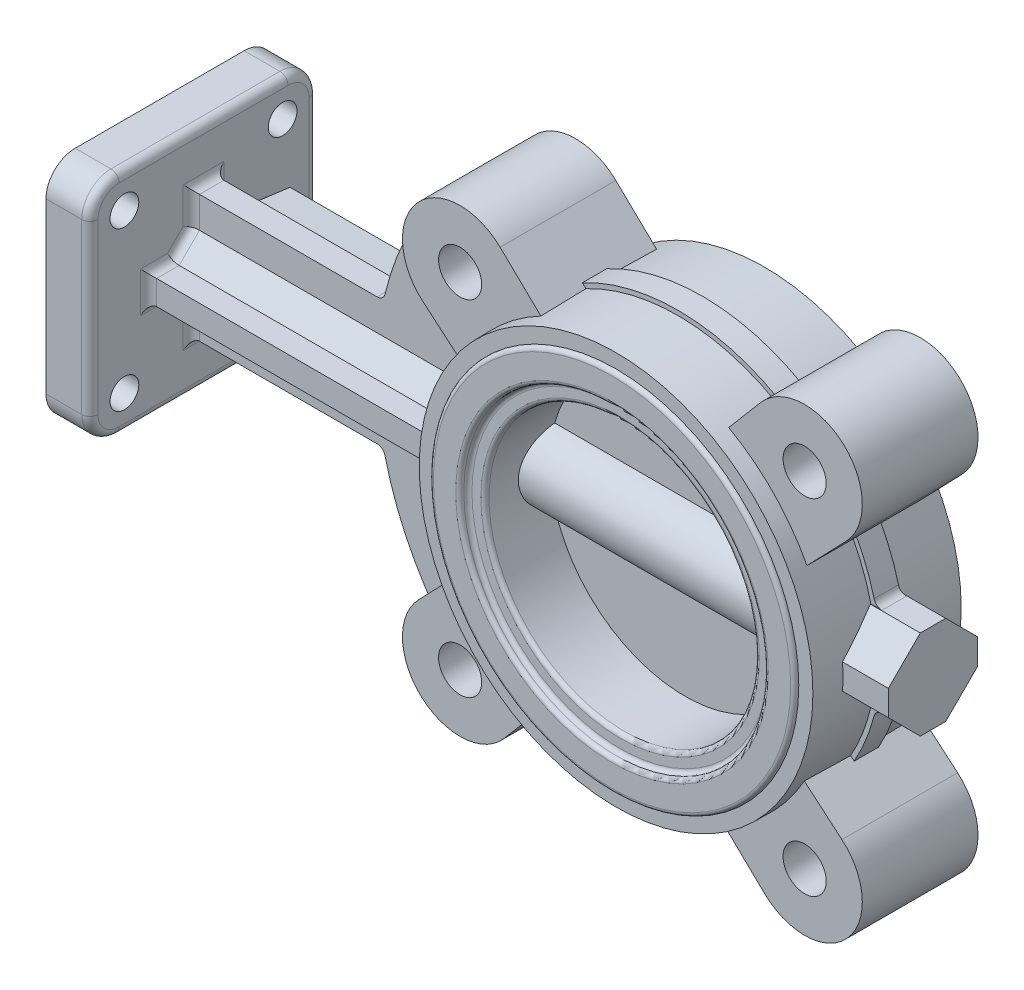
from build123d import *

# Parameters (mm, degrees)
SKETCH1_R                     = 61.976
BOSS_EXTRUDE1_DEPTH           = 23.19655
BOSS_EXTRUDE1_TAPER           = 1
BOSS_EXTRUDE1_OTHER_WAY_DEPTH = 23.19655
BOSS_EXTRUDE1_OTHER_WAY_TAPER = 1
SKETCH2_R                     = 57.15
BOSS_EXTRUDE2_DEPTH           = 1.27
BOSS_EXTRUDE3_START           = 1.27
SKETCH3_R                     = 57.15
BOSS_EXTRUDE3_DEPTH           = 1.27
SKETCH4_R                     = 47.625
CUT_EXTRUDE1_DEPTH            = 2.54
CUT_EXTRUDE2_START            = -2.54
SKETCH5_R                     = 47.625
CUT_EXTRUDE2_DEPTH            = 2.54
SKETCH6_R                     = 42.291
CUT_EXTRUDE3_DEPTH            = 100.168386618
SKETCH7_W                     = 6.35
SKETCH7_H                     = 7.62
SKETCH8_W                     = 27.94
SKETCH8_H                     = 27.94
BOSS_EXTRUDE4_DEPTH           = 18.796
CHAMFER1_SIZE                 = 10
BOSS_EXTRUDE5_DEPTH           = 88.9
BOSS_EXTRUDE5_DEPTH_BACK      = 12.7
BOSS_EXTRUDE6_DEPTH           = 7.62
SKETCH11_W                    = 71.12
SKETCH11_H                    = 71.12
BOSS_EXTRUDE7_DEPTH           = 13.716
CHAMFER2_SIZE                 = 6.35
FILLET1_R                     = 9.144
SKETCH12_W                    = 57.15
SKETCH12_H                    = 31.75
BOSS_EXTRUDE8_DEPTH           = 13.4112
BOSS_EXTRUDE8_TAPER           = 4
FILLET2_R                     = 1.27
FILLET3_R                     = 2.54
SKETCH14_R                    = 9.525
CUT_EXTRUDE5_DEPTH            = 7.62
M8_CLEARANCE_HOLE1_D          = 9
M8_CLEARANCE_HOLE1_DEPTH      = 13.716
SKETCH18_R                    = 11.5
BOSS_EXTRUDE9_DEPTH           = 127
SKETCH19_R                    = 7
BOSS_EXTRUDE10_DEPTH          = 6.62
BOSS_EXTRUDE11_DEPTH          = 19
CHAMFER3_SIZE                 = 1.5
SKETCH21_R                    = 42.291
BOSS_EXTRUDE12_DEPTH          = 1.665
BOSS_EXTRUDE13_DEPTH          = 18.0975
CIRPATTERN1_COUNT             = 4
F_5_8_11_TAPPED_HOLE1_D       = 13.49248


# Some blends are built 0.0001 mm under size
with BuildPart() as part:
    # Sketch1 → Boss-Extrude1 (new body)
    with BuildSketch(Plane.XY):
        Circle(SKETCH1_R)
    extrude(amount=BOSS_EXTRUDE1_DEPTH, taper=BOSS_EXTRUDE1_TAPER)

    # Sketch1 → Boss-Extrude1 other way (add)
    with BuildSketch(Plane.XY):
        Circle(SKETCH1_R)
    extrude(amount=-BOSS_EXTRUDE1_OTHER_WAY_DEPTH, taper=BOSS_EXTRUDE1_OTHER_WAY_TAPER)

    # Sketch2 → Boss-Extrude2 (add)
    with BuildSketch(Plane.XY.offset(23.19655)):
        Circle(SKETCH2_R)
    extrude(amount=BOSS_EXTRUDE2_DEPTH)

    # Sketch3 → Boss-Extrude3 (add)
    with BuildSketch(Plane(origin=(0, 0, -23.19655), x_dir=(-1, 0, 0), z_dir=(0, 0, -1)).offset(BOSS_EXTRUDE3_START)):
        with Locations(Location((0, 0, 0), (0, 0, 180))):
            Circle(SKETCH3_R)
    extrude(amount=-BOSS_EXTRUDE3_DEPTH)

    # Sketch4 → Cut-Extrude1 (cut)
    with BuildSketch(Plane(origin=(0, 0, -24.46655), x_dir=(-1, 0, 0), z_dir=(0, 0, -1))):
        Circle(SKETCH4_R)
    extrude(amount=-CUT_EXTRUDE1_DEPTH, mode=Mode.SUBTRACT)

    # Sketch5 → Cut-Extrude2 (cut)
    with BuildSketch(Plane.XY.offset(24.46655).offset(CUT_EXTRUDE2_START)):
        with Locations(Location((0, 0, 0), (0, 0, 180))):
            Circle(SKETCH5_R)
    extrude(amount=CUT_EXTRUDE2_DEPTH, mode=Mode.SUBTRACT)

    # Sketch6 → Cut-Extrude3 (cut, through all)
    with BuildSketch(Plane.XY.offset(21.92655)):
        Circle(SKETCH6_R)
    extrude(amount=-CUT_EXTRUDE3_DEPTH, mode=Mode.SUBTRACT)

    # Sketch7 → Revolve1 (revolve)
    with BuildSketch(Plane(origin=(0, 0, 0), x_dir=(1, 0, 0), z_dir=(0, 1, 0)), mode=Mode.PRIVATE) as revolve1_sk:
        with Locations((-60.174102714, 0)):
            Rectangle(SKETCH7_W, SKETCH7_H)
    revolve(revolve1_sk.sketch.rotate(Axis((0, 0, 0), (0, 0, -1)), 180), axis=Axis((0, 0, 0), (0, 0, -1)))

    # Sketch8 → Boss-Extrude4 (add)
    with BuildSketch(Plane(origin=(57.15, 0, 0), x_dir=(0, 0, -1), z_dir=(1, 0, 0))):
        Rectangle(SKETCH8_W, SKETCH8_H)
    extrude(amount=BOSS_EXTRUDE4_DEPTH)

    # Chamfer1
    chamfer1_edges = [part.edges().sort_by_distance(p)[0] for p in [
        (68.038336279, 13.97, -13.97),
        (68.038336279, -13.97, -13.97),
        (68.038336279, -13.97, 13.97),
        (68.038336279, 13.97, 13.97),
    ]]
    chamfer(chamfer1_edges, length=CHAMFER1_SIZE)

    # Sketch9 → Boss-Extrude5 (add, two sides: drawn at the far end of the back side and taken through both)
    with BuildSketch(Plane.ZY.offset(63.349102714).offset(-BOSS_EXTRUDE5_DEPTH_BACK)):
        Polygon((-17.2212, 3.81), (-3.81, 3.81), (-3.81, 19.9009), (3.81, 19.9009), (3.81, 3.81), (17.2212, 3.81), (17.2212, -3.81), (3.81, -3.81), (3.81, -19.9009), (-3.81, -19.9009), (-3.81, -3.81), (-17.2212, -3.81), align=None)
    extrude(amount=BOSS_EXTRUDE5_DEPTH + BOSS_EXTRUDE5_DEPTH_BACK)

    # Sketch10 → Boss-Extrude6 (add)
    with BuildSketch(Plane(origin=(0, 0, -3.81), x_dir=(-1, 0, 0), z_dir=(0, 0, -1))):
        with BuildLine():
            Line((44.794580111, 44.794580111), (66.636194495, 66.636194495))
            ThreePointArc((66.636194495, 66.636194495), (82.742592887, 45.104635637), (92.112534504, 19.9009))
            Line((92.112534504, 19.9009), (60.142023526, 19.9009))
            ThreePointArc((60.142023526, 19.9009), (53.924451996, 33.245485281), (44.794580111, 44.794580111))
        make_face()
        with BuildLine():
            Line((44.794580111, -44.794580111), (66.636194495, -66.636194495))
            ThreePointArc((66.636194495, -66.636194495), (82.742592887, -45.104635637), (92.112534504, -19.9009))
            Line((92.112534504, -19.9009), (60.142023526, -19.9009))
            ThreePointArc((60.142023526, -19.9009), (53.924451996, -33.245485281), (44.794580111, -44.794580111))
        make_face()
    extrude(amount=-BOSS_EXTRUDE6_DEPTH)

    # Sketch11 → Boss-Extrude7 (add)
    with BuildSketch(Plane.ZY.offset(152.249102714)):
        Rectangle(SKETCH11_W, SKETCH11_H)
    extrude(amount=BOSS_EXTRUDE7_DEPTH)

    # Chamfer2
    chamfer2_edges = [part.edges().sort_by_distance(p)[0] for p in [
        (-107.020625622, 3.81, 3.81),
        (-107.020625622, -3.81, 3.81),
        (-107.020625622, 3.81, -3.81),
        (-107.020625622, -3.81, -3.81),
    ]]
    chamfer(chamfer2_edges, length=CHAMFER2_SIZE)

    # Fillet1
    fillet1_edges = [part.edges().sort_by_distance(p)[0] for p in [
        (-159.107102714, 35.56, -35.56),
        (-159.107102714, -35.56, -35.56),
        (-159.107102714, -35.56, 35.56),
        (-159.107102714, 35.56, 35.56),
    ]]
    fillet(fillet1_edges, radius=FILLET1_R)

    # Sketch12 → Boss-Extrude8 (add)
    with BuildSketch(Plane(origin=(0, 0, -3.81), x_dir=(-1, 0, 0), z_dir=(0, 0, -1))):
        with Locations((114.784102714, 0)):
            Rectangle(SKETCH12_W, SKETCH12_H)
    extrude(amount=BOSS_EXTRUDE8_DEPTH, taper=BOSS_EXTRUDE8_TAPER)

    # Fillet2
    fillet2_edges = [part.edges().sort_by_distance(p)[0] for p in [
        (-57.15, 0, 24.46655),
        (-57.15, 0, -24.46655),
        (47.625, 0, -24.46655),
        (47.625, 0, 21.92655),
        (47.625, 0, 24.46655),
        (-42.291, 0, -21.92655),
        (-42.291, 0, 21.92655),
    ]]
    fillet(fillet2_edges, radius=FILLET2_R - 0.0001)  # a hair under: the kernel refuses the full size

    # Fillet3
    fillet3_edges = [part.edges().sort_by_distance(p)[0] for p in [
        (-152.249102714, 0, 17.2212),
        (-152.249102714, 3.81, 13.6906),
        (-152.249102714, 19.9009, 0),
        (-152.249102714, 15.03045, -3.81),
        (-152.249102714, 0, -17.2212),
        (-152.249102714, -3.81, -13.6906),
        (-152.249102714, -19.9009, 0),
        (-152.249102714, -15.03045, 3.81),
        (-92.112534504, -19.9009, 0),
        (-44.794580111, -44.794580111, 0),
        (-92.112534504, 19.9009, 0),
        (-44.794580111, 44.794580111, 0),
        (-152.249102714, 15.03045, 3.81),
        (-152.249102714, -3.81, 13.6906),
        (-152.249102714, 3.81, -13.6906),
        (-152.249102714, -15.03045, -3.81),
        (-152.249102714, 6.985, -6.985),
        (-152.249102714, -6.985, -6.985),
        (-152.249102714, -6.985, 6.985),
        (-152.249102714, 6.985, 6.985),
        (-152.249102714, 0, -35.56),
        (-152.249102714, 35.56, 0),
        (-152.249102714, 0, 35.56),
        (-152.249102714, -35.56, 0),
        (-152.249102714, -32.881784407, 32.881784407),
        (-152.249102714, -32.881784407, -32.881784407),
        (-152.249102714, 32.881784407, 32.881784407),
        (-152.249102714, 32.881784407, -32.881784407),
        (61.789545351, 13.97, 0),
        (61.789545351, -13.97, 0),
    ]]
    fillet(fillet3_edges, radius=FILLET3_R)

    # Sketch14 → Cut-Extrude5 (cut)
    with BuildSketch(Plane.ZY.offset(165.965102714)):
        Circle(SKETCH14_R)
    extrude(amount=-CUT_EXTRUDE5_DEPTH, mode=Mode.SUBTRACT)

    # M8 Clearance Hole1
    with Locations(Plane.ZY.offset(165.965102714)):
        with Locations((-24.748737342, 24.748737342), (24.748737342, 24.748737342), (24.748737342, -24.748737342), (-24.748737342, -24.748737342)):
            Hole(M8_CLEARANCE_HOLE1_D / 2, depth=M8_CLEARANCE_HOLE1_DEPTH)

    # Sketch18 → Boss-Extrude9 (add)
    with BuildSketch(Plane(origin=(75.946, 0, 0), x_dir=(0, 0, -1), z_dir=(1, 0, 0))):
        Circle(SKETCH18_R)
    extrude(amount=-BOSS_EXTRUDE9_DEPTH)

    # Sketch19 → Boss-Extrude10 (add)
    with BuildSketch(Plane.ZY.offset(158.345102714)):
        with Locations(Location((0, 0, 0), (0, 0, 180))):
            Circle(SKETCH19_R)
    extrude(amount=BOSS_EXTRUDE10_DEPTH)

    # Sketch20 → Boss-Extrude11 (add)
    with BuildSketch(Plane.ZY.offset(164.965102714)):
        Polygon((0, 7.778174593), (-7.778174593, 0), (0, -7.778174593), (7.778174593, 0), align=None)
    extrude(amount=BOSS_EXTRUDE11_DEPTH)

    # Chamfer3
    # the kernel refuses this chamfer: 1.5 mm, written as the material it takes off along each edge
    with BuildSketch(Plane(origin=(-164.965102714, 0, 7.778174593), x_dir=(0, 0.7262819568766865, -0.6873969152646604), z_dir=(-1, 0, 0)), Plane(origin=(-164.965102714, 7.778174593, 0), x_dir=(0, -0.6873969152646582, -0.7262819568766886), z_dir=(-1, 0, 0)), Plane(origin=(-164.965102714, 0, -7.778174593), x_dir=(0, -0.7262819568766865, 0.6873969152646606), z_dir=(-1, 0, 0))) as chamfer3_piece_1:
        Polygon((CHAMFER3_SIZE * 0.999621916911, CHAMFER3_SIZE * 0.0274958766106), (-CHAMFER3_SIZE * 0.0274958766106, CHAMFER3_SIZE * 0.999621916911), (0, 0), align=None)
    extrude(amount=22.857524482, mode=Mode.SUBTRACT)
    with BuildSketch(Plane(origin=(-164.965102714, -7.778174593, 0), x_dir=(0, 0.6873969152646581, -0.7262819568766888), z_dir=(-1, 0, 0))) as chamfer3_piece_2:
        Polygon((CHAMFER3_SIZE * 0.999621916911, -CHAMFER3_SIZE * 0.0274958766106), (-CHAMFER3_SIZE * 0.0274958766106, -CHAMFER3_SIZE * 0.999621916911), (0, 0), align=None)
    extrude(amount=22.857524482, mode=Mode.SUBTRACT)

    # Sketch21 → Boss-Extrude12 (add, symmetric)
    with BuildSketch(Plane.XY):
        with Locations(Location((0, 0, 0), (0, 0, 344.391643827))):
            Circle(SKETCH21_R)
    extrude(amount=BOSS_EXTRUDE12_DEPTH, both=True)

    # Sketch22 → Boss-Extrude13 (add, symmetric)
    with BuildSketch(Plane.XY):
        with BuildLine():
            Line((66.877897779, 41.372496544), (54.546301318, 28.560491975))
            ThreePointArc((54.546301318, 28.560491975), (44.144359821, 42.921744901), (30.08084786, 53.722837615))
            Line((30.08084786, 53.722837615), (40.132582354, 65.558340252))
            ThreePointArc((40.132582354, 65.558340252), (65.980311794, 67.26066707), (66.877897779, 41.372496544))
        make_face()
    boss_extrude13 = extrude(amount=BOSS_EXTRUDE13_DEPTH, both=True)

    # CirPattern1: Boss-Extrude13 ×4 about axis
    cirpattern1_axis = Axis((0, 0, 0), (0, 0, 1))
    for i in range(1, CIRPATTERN1_COUNT):
        add(boss_extrude13.rotate(cirpattern1_axis, i * 360 / CIRPATTERN1_COUNT))

    # 5/8-11 Tapped Hole1 (through all)
    with Locations(Plane.XY.offset(18.0975)):
        with Locations((-53.881536726, 53.881536726), (53.881536726, 53.881536726), (53.881536726, -53.881536726), (-53.881536726, -53.881536726)):
            Hole(F_5_8_11_TAPPED_HOLE1_D / 2)


solid = part.part
